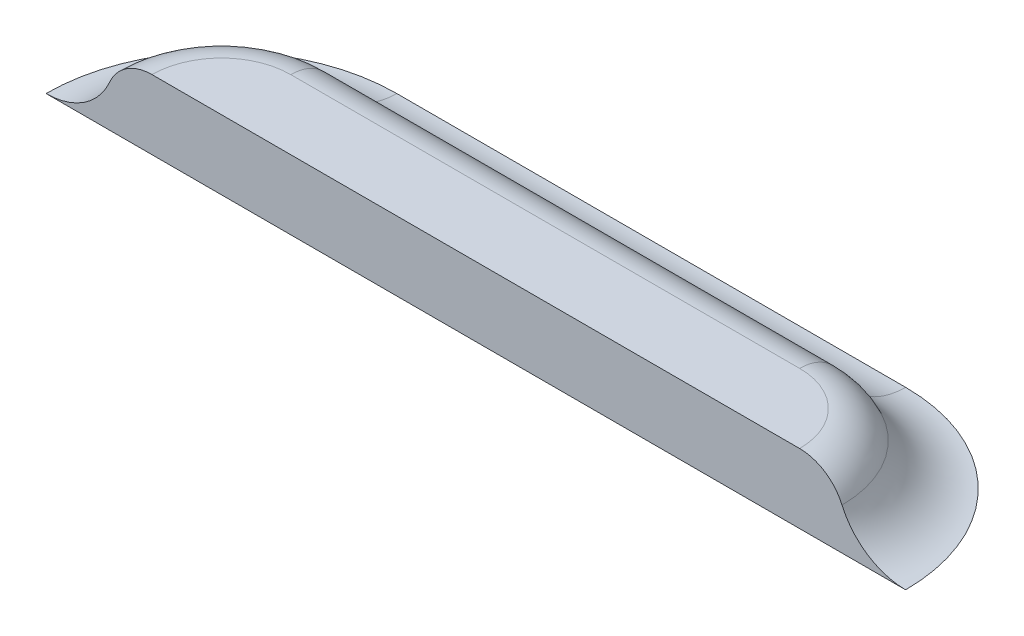
from build123d import *

# Parameters (mm, degrees)
SKETCH1_W           = 152.4
SKETCH1_H           = 50.8
BOSS_EXTRUDE1_DEPTH = 9.525
SKETCH2_W           = 101.6
SKETCH2_H           = 15.875
BOSS_EXTRUDE2_DEPTH = 9.525
FILLET1_R           = 15.875
FILLET2_R           = 6.35
FILLET3_R           = 9.525
SKETCH3_W           = 152.4
SKETCH3_H           = 50.8
CUT_EXTRUDE1_DEPTH  = 81.88464395


# Some blends are built 0.0001 mm under size
with BuildPart() as part:
    # Sketch1 → Boss-Extrude1 (new body)
    with BuildSketch(Plane(origin=(0, 0, 0), x_dir=(1, 0, 0), z_dir=(0, 1, 0))):
        Rectangle(SKETCH1_W, SKETCH1_H)
    extrude(amount=BOSS_EXTRUDE1_DEPTH)

    # Sketch2 → Boss-Extrude2 (add)
    with BuildSketch(Plane(origin=(0, 9.525, 0), x_dir=(1, 0, 0), z_dir=(0, 1, 0))):
        Rectangle(SKETCH2_W, SKETCH2_H)
    extrude(amount=BOSS_EXTRUDE2_DEPTH)

    # Fillet1
    fillet1_edges = [part.edges().sort_by_distance(p)[0] for p in [
        (-50.8, 14.2875, -7.9375),
        (50.8, 14.2875, -7.9375),
    ]]
    fillet(fillet1_edges, radius=FILLET1_R - 0.0001)  # a hair under: the kernel refuses the full size

    # Fillet2
    fillet2_edges = [part.edges().sort_by_distance(p)[0] for p in [
        (0, 19.05, -7.9375),
        (46.150349441, 19.05, -3.287849441),
        (-46.150349441, 19.05, -3.287849441),
    ]]
    fillet(fillet2_edges, radius=FILLET2_R)

    # Fillet3
    # the kernel refuses this fillet: 9.525 mm, written as the material it adds along each edge
    with BuildSketch(Plane(origin=(-34.9251, 9.525, 7.9374), x_dir=(-1, 0, 0), z_dir=(0, 0, 1))) as fillet3_piece_1:
        with BuildLine():
            CenterArc((24.074577831, -9.525), FILLET3_R, 90, 66.421821522)
            Line((24.074577831, 0), (24.074577831, 0.9525))
            Line((24.074577831, 0.9525), (15.8749, 0.9525))
            Line((15.8749, 0.9525), (14.9224, 0))
            ThreePointArc((14.9224, 0), (14.9224, -3.175), (14.471790463, -5.334))
            Line((14.471790463, -5.334), (15.344771133, -5.715))
        make_face()
    revolve(axis=Axis((-34.9251, 9.525, 7.9374), (0, -1, 0)), revolution_arc=90)
    with BuildSketch(Plane(origin=(34.9251, 9.525, 7.9374), x_dir=(0, 0, -1), z_dir=(-1, 0, 0))) as fillet3_piece_2:
        with BuildLine():
            CenterArc((24.074577831, -9.525), FILLET3_R, 90, 66.421821522)
            Line((15.344771133, -5.715), (14.471790463, -5.334))
            ThreePointArc((14.471790463, -5.334), (14.9224, -3.175), (14.9224, 0))
            Line((14.9224, 0), (15.8749, 0.9525))
            Line((15.8749, 0.9525), (24.074577831, 0.9525))
            Line((24.074577831, 0.9525), (24.074577831, 0))
        make_face()
    revolve(axis=Axis((34.9251, 9.525, 7.9374), (0, -1, 0)), revolution_arc=90)
    with BuildSketch(Plane(origin=(-34.9251, 9.525, -7.9375), x_dir=(0, 0, -1), z_dir=(1, 0, 0))) as fillet3_piece_3:
        with BuildLine():
            CenterArc((8.199677831, 9.525), FILLET3_R, 203.578178478, 66.421821522)
            Line((-0.530128867, 5.715), (-1.403109537, 5.334))
            ThreePointArc((-1.403109537, 5.334), (-0.9525, 3.175), (-0.9525, 0))
            Line((-0.9525, 0), (0, -0.9525))
            Line((0, -0.9525), (8.199677831, -0.9525))
            Line((8.199677831, -0.9525), (8.199677831, 0))
        make_face()
    extrude(amount=69.8502)
    with BuildSketch(Plane(origin=(50.8, 9.525, 7.9374), x_dir=(1, 0, 0), z_dir=(0, 0, 1))) as fillet3_piece_4:
        with BuildLine():
            CenterArc((8.199677831, 9.525), FILLET3_R, 203.578178478, 66.421821522)
            Line((-0.530128867, 5.715), (-1.403109537, 5.334))
            ThreePointArc((-1.403109537, 5.334), (-0.9525, 3.175), (-0.9525, 0))
            Line((-0.9525, 0), (0, -0.9525))
            Line((0, -0.9525), (8.199677831, -0.9525))
            Line((8.199677831, -0.9525), (8.199677831, 0))
        make_face()
    extrude(amount=0.0001)
    with BuildSketch(Plane(origin=(-50.8, 9.525, 7.9375), x_dir=(0.09236442858628247, 0.9957252695055647, 0), z_dir=(0, 0, -1))) as fillet3_piece_5:
        with BuildLine():
            CenterArc((8.726924635, -9.044397601), FILLET3_R, 108.27853287, 66.421821522)
            Line((-0.757358557, -8.164626419), (-1.705786877, -8.0766493))
            Line((-1.705786877, -8.0766493), (-0.948428319, 0.087977118))
            Line((-0.948428319, 0.087977118), (0.087977118, 0.948428319))
            ThreePointArc((0.087977118, 0.948428319), (3.249404849, 0.655171258), (5.440795998, 0.90443976))
            Line((5.440795998, 0.90443976), (5.739534965, 0))
        make_face()
    extrude(amount=0.0001)

    # Sketch3 → Cut-Extrude1 (cut, through all)
    with BuildSketch(Plane(origin=(0, 9.525, 0), x_dir=(1, 0, 0), z_dir=(0, 1, 0))):
        Rectangle(SKETCH3_W, SKETCH3_H)
    extrude(amount=-CUT_EXTRUDE1_DEPTH, mode=Mode.SUBTRACT)


solid = part.part
